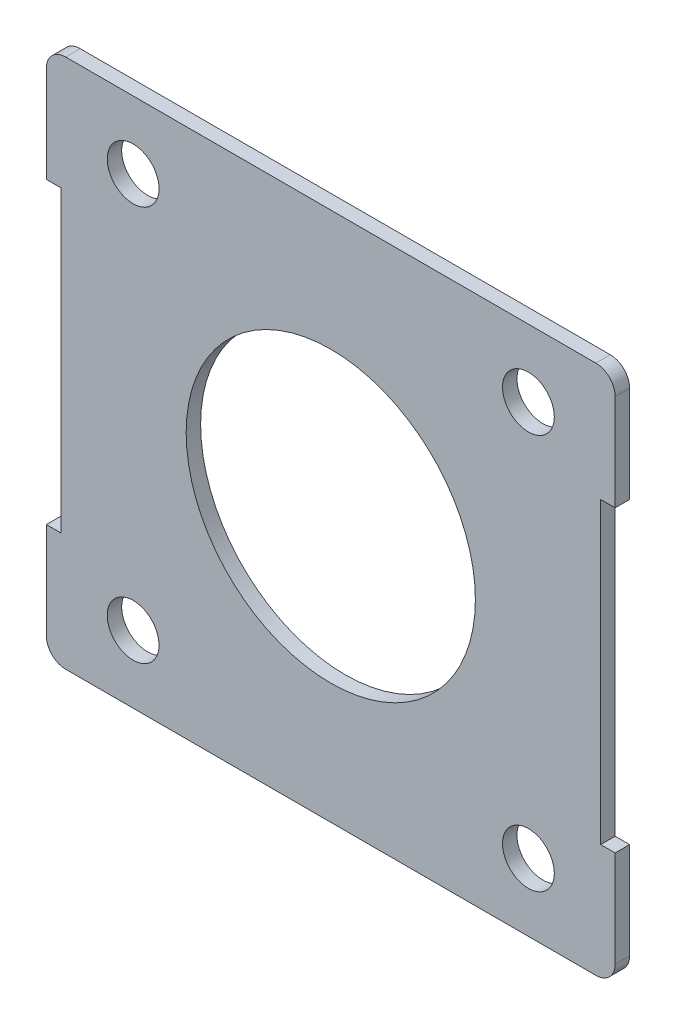
from build123d import *

# Parameters (mm, degrees)
SKETCH1_W          = 187.325
SKETCH1_H          = 174.625
EXTRUDE1_DEPTH     = 4.7625
CUT_EXTRUDE1_REACH = 130.136
SKETCH2_W          = 4.7625
SKETCH2_H          = 98.425
FILLET1_R          = 6.35
CUT_EXTRUDE2_REACH = 130.136
SKETCH3_R          = 47.625
SKETCH3_R_2        = 8.5328125


with BuildPart() as part:
    # Sketch1 → Extrude1 (new body)
    with BuildSketch(Plane.XY):
        Rectangle(SKETCH1_W, SKETCH1_H)
    extrude(amount=EXTRUDE1_DEPTH)

    # Sketch2 → Cut-Extrude1 (cut, up to next)
    with BuildSketch(Plane.XY.offset(4.7625), mode=Mode.PRIVATE) as cut_extrude1_sk1:
        with Locations((-91.28125, 0)):
            Rectangle(SKETCH2_W, SKETCH2_H)
    cut_extrude1_tool1 = extrude(cut_extrude1_sk1.sketch, amount=-CUT_EXTRUDE1_REACH, mode=Mode.PRIVATE) & part.part
    # Sketch2 → Cut-Extrude1 (cut, up to next)
    with BuildSketch(Plane.XY.offset(4.7625), mode=Mode.PRIVATE) as cut_extrude1_sk2:
        with Locations((91.28125, 0)):
            Rectangle(SKETCH2_W, SKETCH2_H)
    cut_extrude1_tool2 = extrude(cut_extrude1_sk2.sketch, amount=-CUT_EXTRUDE1_REACH, mode=Mode.PRIVATE) & part.part
    add(cut_extrude1_tool1.solids().sort_by_distance((-91.28125, 0, 4.7625))[0], mode=Mode.SUBTRACT)
    add(cut_extrude1_tool2.solids().sort_by_distance((91.28125, 0, 4.7625))[0], mode=Mode.SUBTRACT)

    # Fillet1
    fillet1_edges = [part.edges().sort_by_distance(p)[0] for p in [
        (93.6625, -87.3125, 2.38125),
        (93.6625, 87.3125, 2.38125),
        (-93.6625, -87.3125, 2.38125),
        (-93.6625, 87.3125, 2.38125),
    ]]
    fillet(fillet1_edges, radius=FILLET1_R)

    # Sketch3 → Cut-Extrude2 (cut, up to next)
    with BuildSketch(Plane.XY.offset(4.7625), mode=Mode.PRIVATE) as cut_extrude2_sk1:
        Circle(SKETCH3_R)
    cut_extrude2_tool1 = extrude(cut_extrude2_sk1.sketch, amount=-CUT_EXTRUDE2_REACH, mode=Mode.PRIVATE) & part.part
    # Sketch3 → Cut-Extrude2 (cut, up to next)
    with BuildSketch(Plane.XY.offset(4.7625), mode=Mode.PRIVATE) as cut_extrude2_sk2:
        with Locations((-65.0875, 65.0875)):
            Circle(SKETCH3_R_2)
    cut_extrude2_tool2 = extrude(cut_extrude2_sk2.sketch, amount=-CUT_EXTRUDE2_REACH, mode=Mode.PRIVATE) & part.part
    # Sketch3 → Cut-Extrude2 (cut, up to next)
    with BuildSketch(Plane.XY.offset(4.7625), mode=Mode.PRIVATE) as cut_extrude2_sk3:
        with Locations((-65.0875, -65.0875)):
            Circle(SKETCH3_R_2)
    cut_extrude2_tool3 = extrude(cut_extrude2_sk3.sketch, amount=-CUT_EXTRUDE2_REACH, mode=Mode.PRIVATE) & part.part
    # Sketch3 → Cut-Extrude2 (cut, up to next)
    with BuildSketch(Plane.XY.offset(4.7625), mode=Mode.PRIVATE) as cut_extrude2_sk4:
        with Locations((65.0875, -65.0875)):
            Circle(SKETCH3_R_2)
    cut_extrude2_tool4 = extrude(cut_extrude2_sk4.sketch, amount=-CUT_EXTRUDE2_REACH, mode=Mode.PRIVATE) & part.part
    # Sketch3 → Cut-Extrude2 (cut, up to next)
    with BuildSketch(Plane.XY.offset(4.7625), mode=Mode.PRIVATE) as cut_extrude2_sk5:
        with Locations((65.0875, 65.0875)):
            Circle(SKETCH3_R_2)
    cut_extrude2_tool5 = extrude(cut_extrude2_sk5.sketch, amount=-CUT_EXTRUDE2_REACH, mode=Mode.PRIVATE) & part.part
    add(cut_extrude2_tool1.solids().sort_by_distance((0, 0, 4.7625))[0], mode=Mode.SUBTRACT)
    add(cut_extrude2_tool2.solids().sort_by_distance((-65.0875, 65.0875, 4.7625))[0], mode=Mode.SUBTRACT)
    add(cut_extrude2_tool3.solids().sort_by_distance((-65.0875, -65.0875, 4.7625))[0], mode=Mode.SUBTRACT)
    add(cut_extrude2_tool4.solids().sort_by_distance((65.0875, -65.0875, 4.7625))[0], mode=Mode.SUBTRACT)
    add(cut_extrude2_tool5.solids().sort_by_distance((65.0875, 65.0875, 4.7625))[0], mode=Mode.SUBTRACT)


solid = part.part
